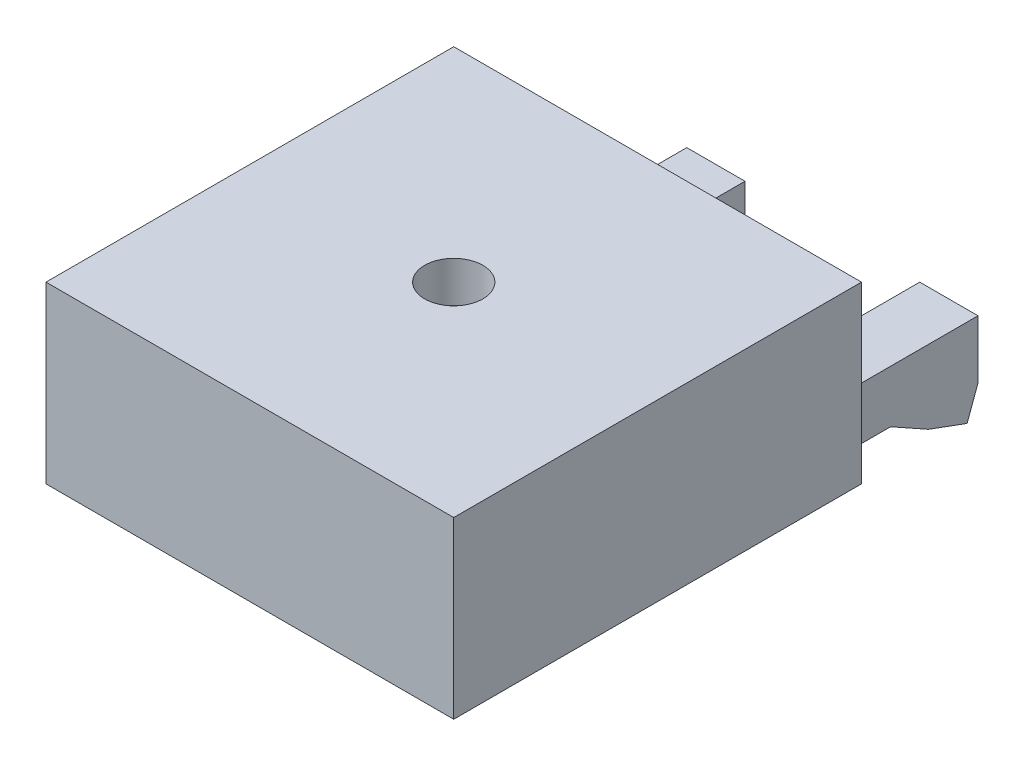
from build123d import *

# Parameters (mm, degrees)
ESQUISSE1_W              = 70
ESQUISSE1_H              = 70
BOSS_EXTRU_4_DEPTH       = 30
ESQUISSE5_W              = 60
ESQUISSE5_H              = 60
ENL_V_MAT_EXTRU_3_DEPTH  = 23
ESQUISSE6_R              = 5
ENL_V_MAT_EXTRU_4_DEPTH  = 23
ESQUISSE28_W             = 10
ESQUISSE28_H             = 30
BOSS_EXTRU_8_DEPTH       = 5
BOSS_EXTRU_9_DEPTH       = 10
ESQUISSE30_W             = 10
ESQUISSE30_H             = 30
BOSS_EXTRU_10_DEPTH      = 5
BOSS_EXTRU_14_DEPTH      = 10
ENL_V_MAT_EXTRU_6_DEPTH  = 10
ENL_V_MAT_EXTRU_15_DEPTH = 14
ENL_V_MAT_EXTRU_16_DEPTH = 10
ENL_V_MAT_EXTRU_17_DEPTH = 10
ENL_V_MAT_EXTRU_18_DEPTH = 10


with BuildPart() as part:
    # Esquisse1 → Boss.-Extru.4 (new body)
    with BuildSketch(Plane(origin=(0, 0, 0), x_dir=(1, 0, 0), z_dir=(0, 1, 0))):
        with Locations((35, 35)):
            Rectangle(ESQUISSE1_W, ESQUISSE1_H)
    extrude(amount=BOSS_EXTRU_4_DEPTH)

    # Esquisse5 → Enlèv. mat.-Extru.3 (cut)
    with BuildSketch(Plane(origin=(0, 0, 0), x_dir=(-1, 0, 0), z_dir=(0, -1, 0))):
        with Locations((-35, 35)):
            Rectangle(ESQUISSE5_W, ESQUISSE5_H)
    extrude(amount=-ENL_V_MAT_EXTRU_3_DEPTH, mode=Mode.SUBTRACT)

    # Esquisse6 → Enlèv. mat.-Extru.4 (cut)
    with BuildSketch(Plane(origin=(0, 23, 0), x_dir=(-1, 0, 0), z_dir=(0, -1, 0))):
        with Locations((-35, 35)):
            Circle(ESQUISSE6_R)
    extrude(amount=-ENL_V_MAT_EXTRU_4_DEPTH, mode=Mode.SUBTRACT)

    # Esquisse28 → Boss.-Extru.8 (add, symmetric)
    with BuildSketch(Plane.XZ):
        with Locations((55.004966989, -85)):
            Rectangle(ESQUISSE28_W, ESQUISSE28_H)
    extrude(amount=BOSS_EXTRU_8_DEPTH, both=True)

    # Esquisse29 → Boss.-Extru.9 (add)
    with BuildSketch(Plane(origin=(60.004966989, 0, 0), x_dir=(0, 0, -1), z_dir=(1, 0, 0))):
        Polygon((98.219627618, -9.8354956), (100, -5), (85, -5), (97.329441427, -12.2532434), align=None)
    extrude(amount=-BOSS_EXTRU_9_DEPTH)

    # Esquisse30 → Boss.-Extru.10 (add, symmetric)
    with BuildSketch(Plane.XZ):
        with Locations((15.004966989, -85)):
            Rectangle(ESQUISSE30_W, ESQUISSE30_H)
    extrude(amount=BOSS_EXTRU_10_DEPTH, both=True)

    # Esquisse39 → Boss.-Extru.14 (add)
    with BuildSketch(Plane.ZY.offset(-10.004966989)):
        Polygon((-100, -5), (-95.960946885, -15.231620103), (-85, -5), align=None)
    extrude(amount=-BOSS_EXTRU_14_DEPTH)

    # Esquisse40 → Enlèv. mat.-Extru.6 (cut)
    with BuildSketch(Plane(origin=(0, -34.827896321, -88.22508495), x_dir=(-1, 0, 0), z_dir=(0, -0.3671866467775486, -0.930147282116257))):
        Polygon((-20.004966989, 21.067928267), (-20.004966989, 22.067928267), (-10.004966989, 21.067928267), align=None)
    extrude(amount=-ENL_V_MAT_EXTRU_6_DEPTH, mode=Mode.SUBTRACT)

    # Esquisse41 → Enlèv. mat.-Extru.15 (cut)
    with BuildSketch(Plane(origin=(0, -33.020314107, -89.683251213), x_dir=(-1, 0, 0), z_dir=(0, -0.34551294756569506, -0.9384139827733097))):
        Polygon((-60.004966989, 23.129967252), (-60.004966989, 22.129967252), (-50.004966989, 22.129967252), align=None)
    extrude(amount=-ENL_V_MAT_EXTRU_15_DEPTH, mode=Mode.SUBTRACT)

    # Esquisse43 → Enlèv. mat.-Extru.16 (cut)
    with BuildSketch(Plane(origin=(0, -33.020314107, -89.683251213), x_dir=(-1, 0, 0), z_dir=(0, -0.345512947565695, -0.9384139827733096))):
        Polygon((-50.004966989, 22.129967252), (-50.004966989, 23.329813083), (-60.004966989, 24.447460133), (-60.004966989, 23.129967252), align=None)
    extrude(amount=-ENL_V_MAT_EXTRU_16_DEPTH, mode=Mode.SUBTRACT)

    # Esquisse44 → Enlèv. mat.-Extru.17 (cut)
    with BuildSketch(Plane.ZY.offset(-50.004966989)):
        Polygon((-70, -5), (-70, -4.002738473), (-84.995855928, -4.002738473), (-97.744003697, -11.127291295), (-91.520267767, -8.835785216), (-85, -5), align=None)
    extrude(amount=-ENL_V_MAT_EXTRU_17_DEPTH, mode=Mode.SUBTRACT)

    # Esquisse45 → Enlèv. mat.-Extru.18 (cut)
    with BuildSketch(Plane(origin=(0, -34.827896321, -88.22508495), x_dir=(-1, 0, 0), z_dir=(0, -0.3671866467775486, -0.930147282116257))):
        Polygon((-20.004966989, 22.067928267), (-20.004966989, 22.185575327), (-10.004966989, 21.067928267), align=None)
    extrude(amount=-ENL_V_MAT_EXTRU_18_DEPTH, mode=Mode.SUBTRACT)


solid = part.part
